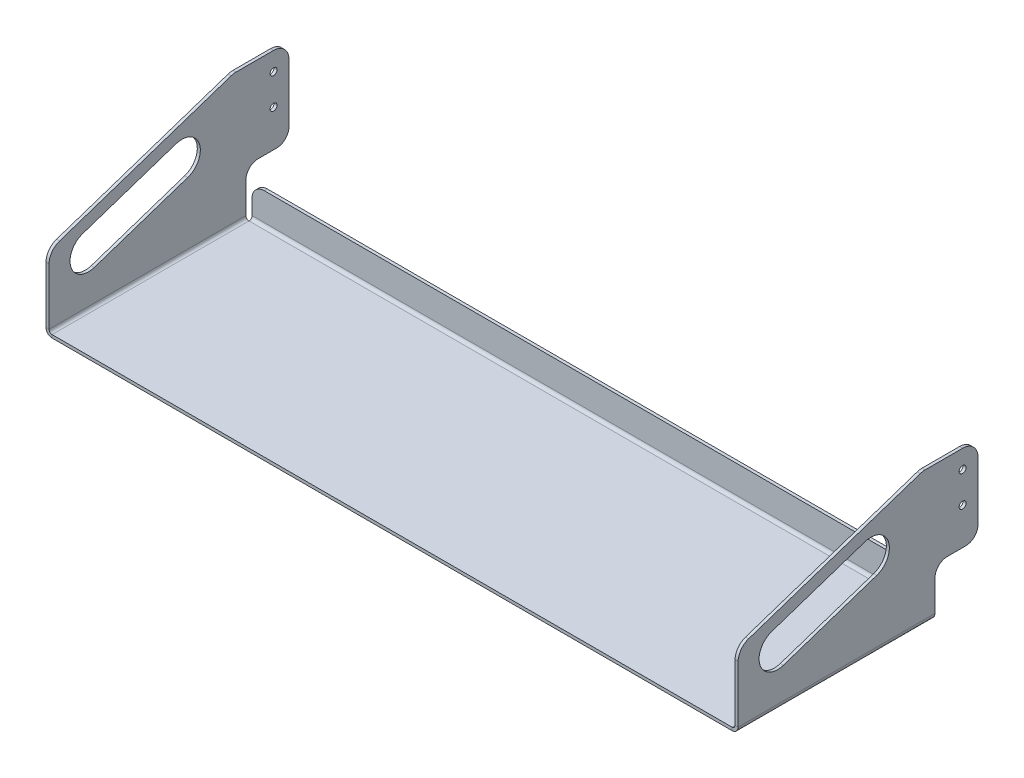
from build123d import *

# Parameters (mm, degrees)
BASE_FLANGE1_DEPTH              = 203.2
SKETCH6_W                       = 44.40682
SKETCH6_H                       = 88.9
BOSS_EXTRUDE1_DEPTH             = 3.13182
SKETCH7_W                       = 44.40682
SKETCH7_H                       = 88.9
BOSS_EXTRUDE2_DEPTH             = 3.13182
CUT_EXTRUDE1_DEPTH              = 756.082359098
F_9_32_0_28125_DIAMETER_HOLE1_D = 7.14375
EDGE_FLANGE1_DEPTH              = 701.675
FILLET1_R                       = 12.7
FILLET2_R                       = 15.875


# Sheet-metal steps are written as plain solids
with BuildPart() as part:
    # Sketch1 → Base-Flange1 (new body)
    with BuildSketch(Plane.XY):
        with BuildLine():
            Line((-354.0125, 136.56818), (-354.0125, 3.175))
            ThreePointArc((-354.0125, 3.175), (-353.08256403, 0.92993597), (-350.8375, 0))
            Line((-350.8375, 0), (350.8375, 0))
            ThreePointArc((350.8375, 0), (353.08256403, 0.92993597), (354.0125, 3.175))
            Line((354.0125, 3.175), (354.0125, 136.56818))
            Line((354.0125, 136.56818), (357.14432, 136.56818))
            Line((357.14432, 136.56818), (357.14432, 3.175))
            ThreePointArc((357.14432, 3.175), (355.29709519, -1.28459519), (350.8375, -3.13182))
            Line((350.8375, -3.13182), (-350.8375, -3.13182))
            ThreePointArc((-350.8375, -3.13182), (-355.29709519, -1.28459519), (-357.14432, 3.175))
            Line((-357.14432, 3.175), (-357.14432, 136.56818))
            Line((-357.14432, 136.56818), (-354.0125, 136.56818))
        make_face()
    extrude(amount=BASE_FLANGE1_DEPTH)

    # Sketch6 → Boss-Extrude1 (add)
    with BuildSketch(Plane(origin=(357.14432, 0, 0), x_dir=(0, 0, -1), z_dir=(1, 0, 0))):
        with Locations((22.20341, 92.11818)):
            Rectangle(SKETCH6_W, SKETCH6_H)
    extrude(amount=-BOSS_EXTRUDE1_DEPTH)

    # Sketch7 → Boss-Extrude2 (add)
    with BuildSketch(Plane.ZY.offset(357.14432)):
        with Locations((-22.20341, 92.11818)):
            Rectangle(SKETCH7_W, SKETCH7_H)
    extrude(amount=-BOSS_EXTRUDE2_DEPTH)

    # Sketch8 → Cut-Extrude1 (cut, through all)
    with BuildSketch(Plane.ZY.offset(357.14432)):
        with BuildLine():
            Line((72.133349274, 103.379689668), (168.517386933, 71.244393115))
            ThreePointArc((168.517386933, 71.244393115), (180.56402589, 47.14701795), (156.466650726, 35.100378992))
            Line((156.466650726, 35.100378992), (60.082613067, 67.235675546))
            ThreePointArc((60.082613067, 67.235675546), (48.03597411, 91.333050711), (72.133349274, 103.379689668))
        make_face()
        Polygon((12.74318, 136.56818), (203.2, 73.06818), (203.2, 136.56818), align=None)
    extrude(amount=-CUT_EXTRUDE1_DEPTH, mode=Mode.SUBTRACT)

    # 9/32 (0.28125) Diameter Hole1 (through all)
    with Locations(Plane.ZY.offset(357.14432)):
        with Locations((-28.53182, 85.76818), (-28.53182, 117.51818)):
            Hole(F_9_32_0_28125_DIAMETER_HOLE1_D / 2)

    # Edge-Flange1 section (across the edge) → Edge-Flange1 (add)
    with BuildSketch(Plane(origin=(350.8375, 0, -3.175), x_dir=(0, 0, 1), z_dir=(-1, 0, 0))):
        with BuildLine():
            Line((-3.13182, 3.175), (-3.13182, 31.75))
            Line((-3.13182, 31.75), (0, 31.75))
            Line((0, 31.75), (0, 3.175))
            ThreePointArc((0, 3.175), (0.92993597, 0.92993597), (3.175, 0))
            Line((3.175, 0), (3.175, -3.13182))
            ThreePointArc((3.175, -3.13182), (-1.28459519, -1.28459519), (-3.13182, 3.175))
        make_face()
    extrude(amount=EDGE_FLANGE1_DEPTH)

    # Fillet1
    fillet1_edges = [part.edges().sort_by_distance(p)[0] for p in [
        (350.8375, 31.75, -4.74091),
        (-350.8375, 31.75, -4.74091),
        (355.57841, 47.66818, -44.40682),
        (355.57841, 47.66818, 0),
        (-355.57841, 47.66818, 0),
        (-355.57841, 47.66818, -44.40682),
    ]]
    fillet(fillet1_edges, radius=FILLET1_R)

    # Fillet2
    fillet2_edges = [part.edges().sort_by_distance(p)[0] for p in [
        (355.57841, 136.56818, -44.40682),
        (-355.57841, 136.56818, -44.40682),
        (-355.57841, 73.06818, 203.2),
        (355.57841, 73.06818, 203.2),
        (355.57841, 136.56818, 12.74318),
        (-355.57841, 136.56818, 12.74318),
    ]]
    fillet(fillet2_edges, radius=FILLET2_R)


solid = part.part
